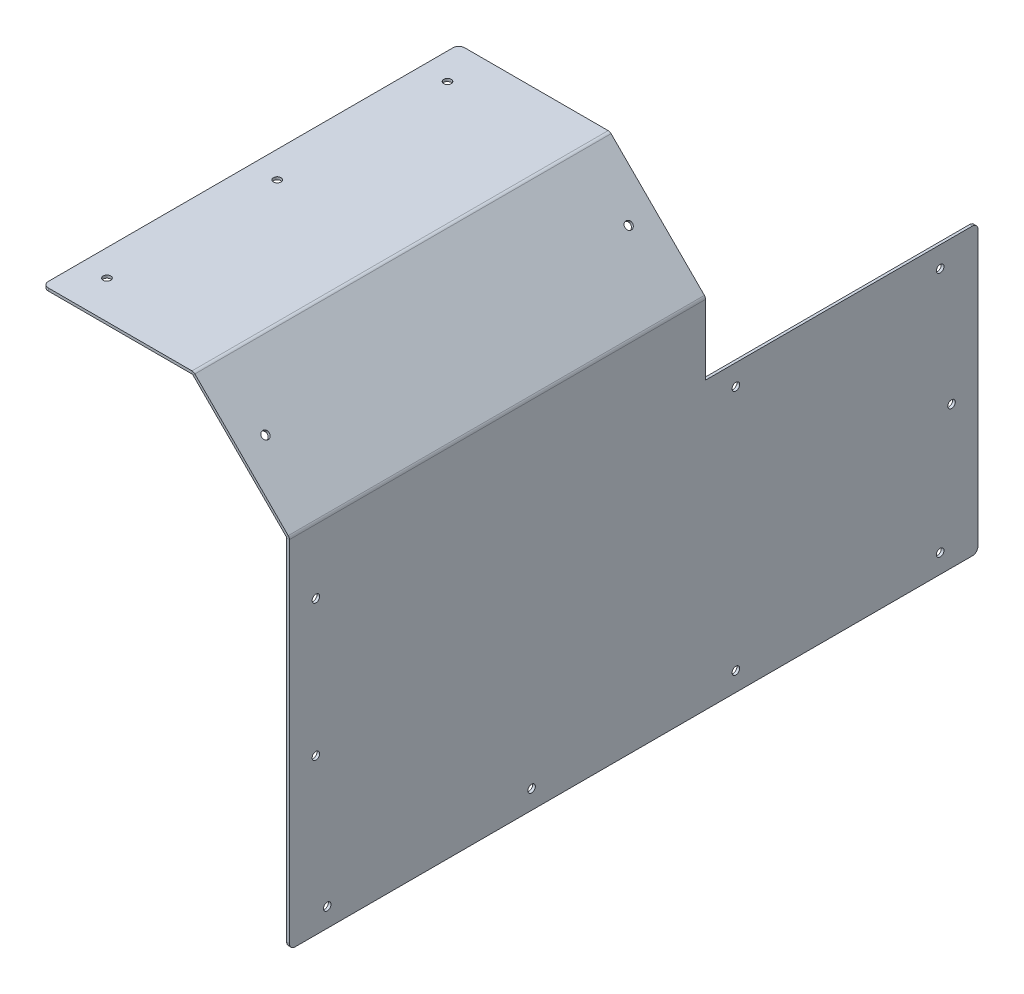
from build123d import *

# Parameters (mm, degrees)
BASE_FLANGE1_DEPTH                     = 577.85
SKETCH5_W                              = 369.801004036
SKETCH5_H                              = 271.212830699
CE_00_NOTCH_DEPTH                      = 254
SKETCH9_R                              = 3.175
CE_00_HOLES_0_250_SIDE_9_PLACES_DEPTH  = 7.62
SKETCH10_R                             = 3.175
CE_00_HOLES_0_250_ANGLE_2_PLACES_DEPTH = 7.62
SKETCH8_R                              = 3.175
CE_00_HOLES_0_250_TOP_3_PLACES_DEPTH   = 7.62
FILLET1_R                              = 4.7752


# Sheet-metal steps are written as plain solids
with BuildPart() as part:
    # Sketch1 → Base-Flange1 (new body)
    with BuildSketch(Plane.XY):
        with BuildLine():
            Line((144.4752, -233.3752), (144.4752, 65.007753898))
            ThreePointArc((144.4752, 65.007753898), (144.388194306, 65.445161061), (144.140423051, 65.815976949))
            Line((144.140423051, 65.815976949), (65.815976949, 144.140423051))
            ThreePointArc((65.815976949, 144.140423051), (65.445161061, 144.388194306), (65.007753898, 144.4752))
            Line((65.007753898, 144.4752), (-60.325, 144.4752))
            Line((-60.325, 144.4752), (-60.325, 146.7612))
            Line((-60.325, 146.7612), (65.007753898, 146.7612))
            ThreePointArc((65.007753898, 146.7612), (66.319975388, 146.500182917), (67.432423051, 145.756869153))
            Line((67.432423051, 145.756869153), (145.756869153, 67.432423051))
            ThreePointArc((145.756869153, 67.432423051), (146.500182917, 66.319975388), (146.7612, 65.007753898))
            Line((146.7612, 65.007753898), (146.7612, -233.3752))
            Line((146.7612, -233.3752), (144.4752, -233.3752))
        make_face()
    extrude(amount=-BASE_FLANGE1_DEPTH)

    # Sketch5 → CE-00 Notch (cut, symmetric)
    with BuildSketch(Plane(origin=(0, 0, 0), x_dir=(0, 0, -1), z_dir=(1, 0, 0))):
        with Locations((534.150502018, 141.95641535)):
            Rectangle(SKETCH5_W, SKETCH5_H)
    extrude(amount=CE_00_NOTCH_DEPTH, both=True, mode=Mode.SUBTRACT)

    # Sketch9 → CE-00 Holes 0.250 Side 9 Places (cut)
    with BuildSketch(Plane(origin=(146.7612, 0, 0), x_dir=(0, 0, -1), z_dir=(1, 0, 0))):
        with Locations(Location((31.75, -217.5002, 0), (0, 0, 90))):
            Circle(SKETCH9_R)
        with Locations(Location((203.2, -217.5002, 0), (0, 0, 90))):
            Circle(SKETCH9_R)
        with Locations(Location((374.65, -217.5002, 0), (0, 0, 90))):
            Circle(SKETCH9_R)
        with Locations(Location((546.1, -217.5002, 0), (0, 0, 90))):
            Circle(SKETCH9_R)
        with Locations(Location((546.1, -11.1252, 0), (0, 0, 90))):
            Circle(SKETCH9_R)
        with Locations(Location((374.65, -11.1252, 0), (0, 0, 90))):
            Circle(SKETCH9_R)
        with Locations(Location((22.225, 11.0998, 0), (0, 0, 90))):
            Circle(SKETCH9_R)
        with Locations(Location((22.225, -103.2002, 0), (0, 0, 90))):
            Circle(SKETCH9_R)
        with Locations(Location((555.625, -114.3127, 0), (0, 0, 90))):
            Circle(SKETCH9_R)
    extrude(amount=-CE_00_HOLES_0_250_SIDE_9_PLACES_DEPTH, mode=Mode.SUBTRACT)

    # Sketch10 → CE-00 Holes 0.250 Angle 2 Places (cut)
    with BuildSketch(Plane(origin=(106.594646102, 106.594646102, 0), x_dir=(0, 0, -1), z_dir=(0.7071067811865511, 0.707106781186544, 0))):
        with Locations(Location((22.225, 3.025193073, 0), (0, 0, 90))):
            Circle(SKETCH10_R)
        with Locations(Location((327.025, 3.025193073, 0), (0, 0, 90))):
            Circle(SKETCH10_R)
    extrude(amount=-CE_00_HOLES_0_250_ANGLE_2_PLACES_DEPTH, mode=Mode.SUBTRACT)

    # Sketch8 → CE-00 Holes 0.250 Top 3 Places (cut)
    with BuildSketch(Plane(origin=(0, 146.7612, 0), x_dir=(1, 0, 0), z_dir=(0, 1, 0))):
        with Locations(Location((-38.1, 31.75, 0), (0, 0, 180))):
            Circle(SKETCH8_R)
        with Locations(Location((-38.1, 317.5, 0), (0, 0, 180))):
            Circle(SKETCH8_R)
        with Locations(Location((-38.1, 174.625, 0), (0, 0, 180))):
            Circle(SKETCH8_R)
    extrude(amount=-CE_00_HOLES_0_250_TOP_3_PLACES_DEPTH, mode=Mode.SUBTRACT)

    # Fillet1
    fillet1_edges = [part.edges().sort_by_distance(p)[0] for p in [
        (145.6182, -233.3752, 0),
        (-60.325, 145.6182, 0),
        (145.6182, -233.3752, -577.85),
        (-60.325, 145.6182, -349.25),
        (145.6182, 6.35, -577.85),
    ]]
    fillet(fillet1_edges, radius=FILLET1_R)


solid = part.part
